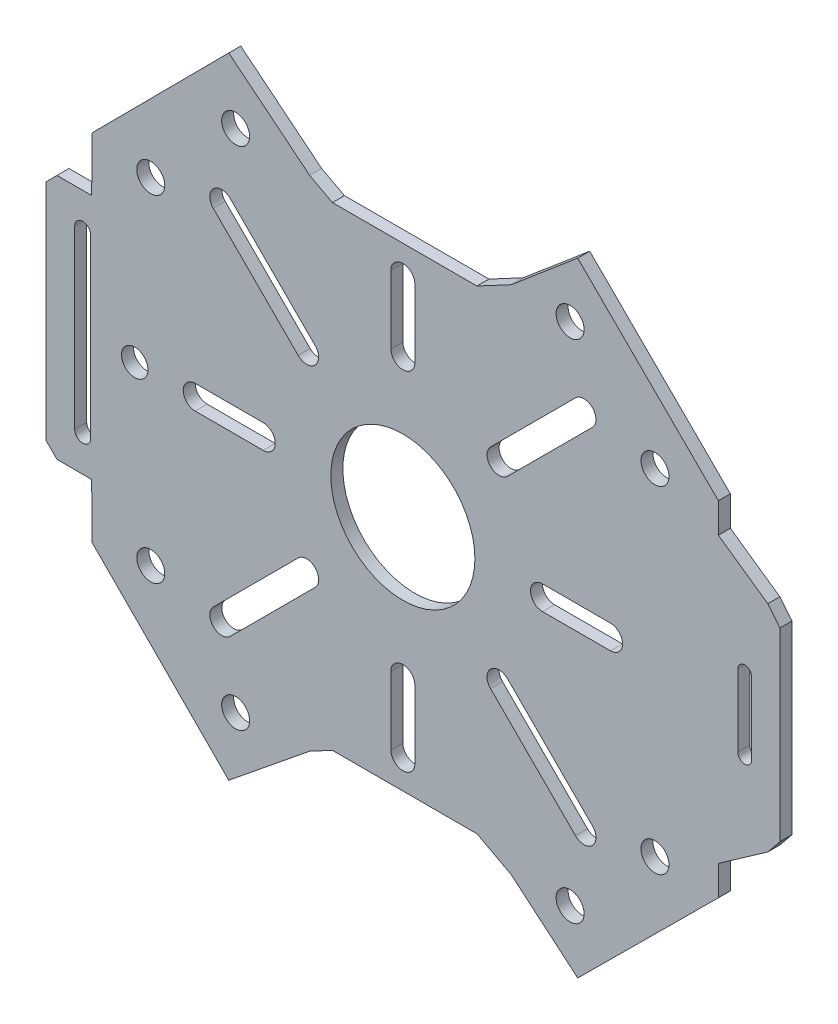
from build123d import *

# Parameters (mm, degrees)
UPPER_BOARD_R   = 9
UPPER_BOARD_R_2 = 1.75
UPPER_BOARD_R_3 = 1.65
EXTRUDE_1_DEPTH = 1.5


with BuildPart() as part:
    # Upper_board → 凸台-拉伸1 (new body)
    with BuildSketch(Plane.XY):
        Polygon((0, 29.63770528), (9.258229776, 29.63770528), (13.530145247, 31.914413679), (21.845237215, 38.947274579), (39.422116781, 21.483203913), (39.422116781, 17.759375685), (45.602672711, 13.431703833), (47.117107925, 11.564161962), (47.117107925, -11.564161962), (45.602672711, -13.431703833), (39.422116781, -17.759375685), (39.422116781, -21.483203913), (21.845237215, -38.947274579), (13.530145247, -31.914413679), (9.258229776, -29.63770528), (0, -29.63770528), (-8.800437365, -29.63770528), (-11.64882797, -31.155749084), (-21.754927214, -39.351031245), (-38.850540354, -22.144989251), (-38.878084859, -15.364158174), (-43.219581062, -15.364158174), (-44.585312397, -13.989604918), (-44.585312397, 13.989604918), (-43.219581062, 15.364158174), (-38.878084859, 15.364158174), (-38.850540354, 22.144989251), (-21.754927214, 39.351031245), (-11.64882797, 31.155749084), (-8.800437365, 29.63770528), align=None)
        Circle(UPPER_BOARD_R, mode=Mode.SUBTRACT)
        with Locations((-20.893398282, 31.606601718)):
            Circle(UPPER_BOARD_R_2, mode=Mode.SUBTRACT)
        with Locations((-31.5, 21)):
            Circle(UPPER_BOARD_R_2, mode=Mode.SUBTRACT)
        with Locations((-33.5, 0)):
            Circle(UPPER_BOARD_R_3, mode=Mode.SUBTRACT)
        with Locations((20.893398282, 31.606601718)):
            Circle(UPPER_BOARD_R_2, mode=Mode.SUBTRACT)
        with Locations((31.5, 21)):
            Circle(UPPER_BOARD_R_2, mode=Mode.SUBTRACT)
        with Locations((-20.893398282, -31.606601718)):
            Circle(UPPER_BOARD_R_2, mode=Mode.SUBTRACT)
        with Locations((-31.5, -21)):
            Circle(UPPER_BOARD_R_2, mode=Mode.SUBTRACT)
        with Locations((20.893398282, -31.606601718)):
            Circle(UPPER_BOARD_R_2, mode=Mode.SUBTRACT)
        with Locations((31.5, -21)):
            Circle(UPPER_BOARD_R_2, mode=Mode.SUBTRACT)
        with BuildLine():
            Line((-21.566327477, 23.687647821), (-10.960584458, 13.081904801))
            ThreePointArc((-10.960584458, 13.081904801), (-10.960584458, 10.960584458), (-13.081904801, 10.960584458))
            Line((-13.081904801, 10.960584458), (-23.687647821, 21.566327477))
            ThreePointArc((-23.687647821, 21.566327477), (-23.687647821, 23.687647821), (-21.566327477, 23.687647821))
        make_face(mode=Mode.SUBTRACT)
        with BuildLine():
            Line((-1.5, 17.445654013), (-1.5, 25.945654013))
            ThreePointArc((-1.5, 25.945654013), (0, 27.445654013), (1.5, 25.945654013))
            Line((1.5, 25.945654013), (1.5, 17.445654013))
            ThreePointArc((1.5, 17.445654013), (0, 15.945654013), (-1.5, 17.445654013))
        make_face(mode=Mode.SUBTRACT)
        with BuildLine():
            Line((-1.5, -17.445654013), (-1.5, -25.945654013))
            ThreePointArc((-1.5, -25.945654013), (0, -27.445654013), (1.5, -25.945654013))
            Line((1.5, -25.945654013), (1.5, -17.445654013))
            ThreePointArc((1.5, -17.445654013), (0, -15.945654013), (-1.5, -17.445654013))
        make_face(mode=Mode.SUBTRACT)
        with BuildLine():
            Line((-17.445654013, 1.5), (-25.945654013, 1.5))
            ThreePointArc((-25.945654013, 1.5), (-27.445654013, 0), (-25.945654013, -1.5))
            Line((-25.945654013, -1.5), (-17.445654013, -1.5))
            ThreePointArc((-17.445654013, -1.5), (-15.945654013, 0), (-17.445654013, 1.5))
        make_face(mode=Mode.SUBTRACT)
        with BuildLine():
            Line((17.445654013, 1.5), (25.945654013, 1.5))
            ThreePointArc((25.945654013, 1.5), (27.445654013, 0), (25.945654013, -1.5))
            Line((25.945654013, -1.5), (17.445654013, -1.5))
            ThreePointArc((17.445654013, -1.5), (15.945654013, 0), (17.445654013, 1.5))
        make_face(mode=Mode.SUBTRACT)
        with BuildLine():
            Line((-21.566327477, -23.687647821), (-10.960584458, -13.081904801))
            ThreePointArc((-10.960584458, -13.081904801), (-10.960584458, -10.960584458), (-13.081904801, -10.960584458))
            Line((-13.081904801, -10.960584458), (-23.687647821, -21.566327477))
            ThreePointArc((-23.687647821, -21.566327477), (-23.687647821, -23.687647821), (-21.566327477, -23.687647821))
        make_face(mode=Mode.SUBTRACT)
        with BuildLine():
            Line((21.566327477, 23.687647821), (10.960584458, 13.081904801))
            ThreePointArc((10.960584458, 13.081904801), (10.960584458, 10.960584458), (13.081904801, 10.960584458))
            Line((13.081904801, 10.960584458), (23.687647821, 21.566327477))
            ThreePointArc((23.687647821, 21.566327477), (23.687647821, 23.687647821), (21.566327477, 23.687647821))
        make_face(mode=Mode.SUBTRACT)
        with BuildLine():
            Line((21.566327477, -23.687647821), (10.960584458, -13.081904801))
            ThreePointArc((10.960584458, -13.081904801), (10.960584458, -10.960584458), (13.081904801, -10.960584458))
            Line((13.081904801, -10.960584458), (23.687647821, -21.566327477))
            ThreePointArc((23.687647821, -21.566327477), (23.687647821, -23.687647821), (21.566327477, -23.687647821))
        make_face(mode=Mode.SUBTRACT)
        with BuildLine():
            Line((-41, -11), (-41, 11))
            ThreePointArc((-41, 11), (-40, 12), (-39, 11))
            Line((-39, 11), (-39, -11))
            ThreePointArc((-39, -11), (-40, -12), (-41, -11))
        make_face(mode=Mode.SUBTRACT)
        with BuildLine():
            Line((41.855351652, -4.5), (41.855351652, 4.5))
            ThreePointArc((41.855351652, 4.5), (42.721395453, 5.366043802), (43.587439255, 4.5))
            Line((43.587439255, 4.5), (43.587439255, -4.5))
            ThreePointArc((43.587439255, -4.5), (42.721395453, -5.366043802), (41.855351652, -4.5))
        make_face(mode=Mode.SUBTRACT)
    extrude(amount=EXTRUDE_1_DEPTH)


solid = part.part
